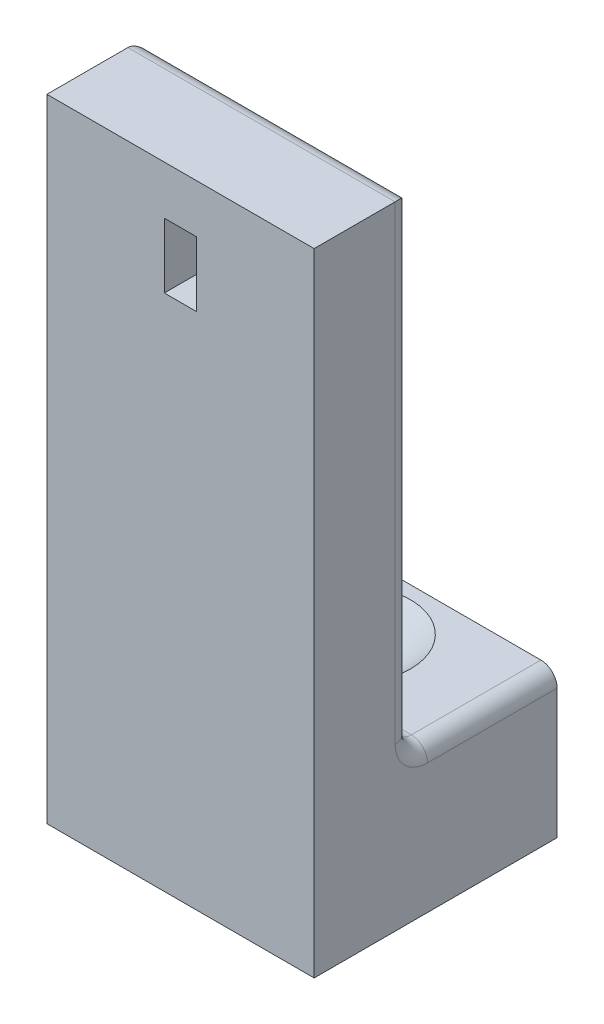
from build123d import *

# Parameters (mm, degrees)
SKETCH1_W               = 16.5
SKETCH1_H               = 15
SKETCH1_R               = 2.2
BOSS_EXTRUDE1_DEPTH     = 9
CHAMFER1_SIZE           = 1.5
SKETCH2_W               = 16.5
SKETCH2_H               = 6
BOSS_EXTRUDE2_DEPTH     = 30
CUT_EXTRUDE2_DEPTH      = 41.866398177
CUT_EXTRUDE2_DEPTH_BACK = 41.866398177
SKETCH4_W               = 2
SKETCH4_H               = 4
SKETCH4_3_W             = 4
SKETCH4_3_H             = 6
SKETCH4_3_W_2           = 2
SKETCH4_3_H_2           = 4
CUT_EXTRUDE3_DEPTH      = 1
FILLET1_R               = 1
SKETCH7_W               = 4
SKETCH7_H               = 1
BOSS_EXTRUDE4_DEPTH     = 1


with BuildPart() as part:
    # Sketch1 → Boss-Extrude1 (new body)
    with BuildSketch(Plane(origin=(0, 0, 0), x_dir=(1, 0, 0), z_dir=(0, 1, 0))):
        Rectangle(SKETCH1_W, SKETCH1_H)
        with Locations((0, 3)):
            Circle(SKETCH1_R, mode=Mode.SUBTRACT)
    extrude(amount=BOSS_EXTRUDE1_DEPTH)

    # Chamfer1
    chamfer1_edges = [part.edges().sort_by_distance(p)[0] for p in [
        (-2.2, 9, -3),
    ]]
    chamfer(chamfer1_edges, length=CHAMFER1_SIZE)

    # Sketch2 → Boss-Extrude2 (add)
    with BuildSketch(Plane(origin=(0, 9, 0), x_dir=(1, 0, 0), z_dir=(0, 1, 0))):
        with Locations((0, -4.5)):
            Rectangle(SKETCH2_W, SKETCH2_H)
    extrude(amount=BOSS_EXTRUDE2_DEPTH)

    # Sketch4 → Cut-Extrude2 (cut, two sides: drawn at the far end of the back side and taken through both)
    with BuildSketch(Plane(origin=(0, 0, 1.5), x_dir=(-1, 0, 0), z_dir=(0, 0, -1)).offset(-CUT_EXTRUDE2_DEPTH_BACK)):
        with Locations((0, 34)):
            Rectangle(SKETCH4_W, SKETCH4_H)
    extrude(amount=CUT_EXTRUDE2_DEPTH + CUT_EXTRUDE2_DEPTH_BACK, mode=Mode.SUBTRACT)

    # Sketch4<3> → Cut-Extrude3 (cut)
    with BuildSketch(Plane(origin=(0, 0, 1.5), x_dir=(-1, 0, 0), z_dir=(0, 0, -1))):
        with Locations((0, 34)):
            Rectangle(SKETCH4_3_W, SKETCH4_3_H)
        with Locations((0, 34)):
            Rectangle(SKETCH4_3_W_2, SKETCH4_3_H_2, mode=Mode.SUBTRACT)
    extrude(amount=-CUT_EXTRUDE3_DEPTH, mode=Mode.SUBTRACT)

    # Fillet1
    fillet1_edges = [part.edges().sort_by_distance(p)[0] for p in [
        (8.25, 24, 1.5),
        (-8.25, 9, -3),
        (0, 39, 1.5),
        (8.25, 9, -3),
        (-8.25, 24, 1.5),
        (0, 9, 1.5),
    ]]
    fillet(fillet1_edges, radius=FILLET1_R)

    # Sketch7 → Boss-Extrude4 (add)
    with BuildSketch(Plane(origin=(0, 0, 2.5), x_dir=(-1, 0, 0), z_dir=(0, 0, -1))):
        with Locations((0, 31.5)):
            Rectangle(SKETCH7_W, SKETCH7_H)
    extrude(amount=BOSS_EXTRUDE4_DEPTH)


solid = part.part
